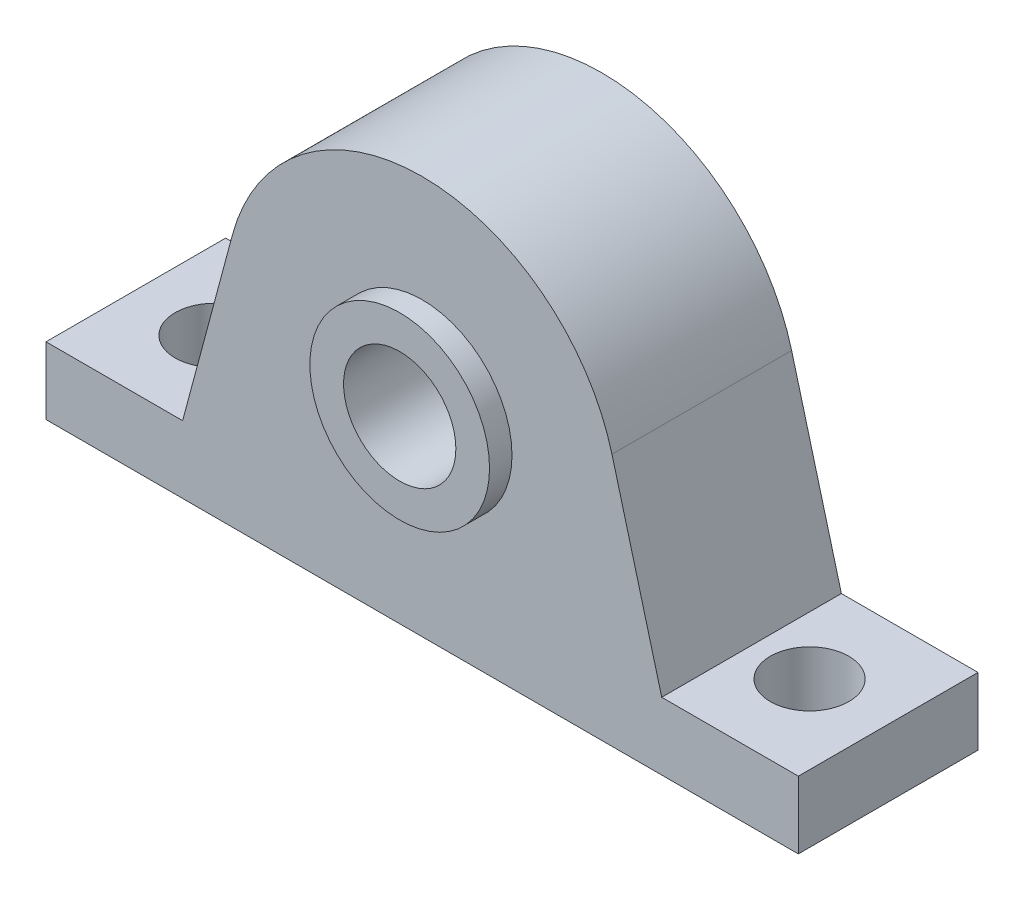
from build123d import *

# Parameters (mm, degrees)
SKETCH_1_R          = 5
EXTRUDE_1_DEPTH     = 16
SKETCH_2_R          = 8
SKETCH_2_R_2        = 5
EXTRUDE_2_DEPTH     = 2
SKETCH_3_R          = 3.5
CUT_EXTRUDE_1_DEPTH = 12


with BuildPart() as part:
    # 草图1 → 凸台-拉伸1 (new body)
    with BuildSketch(Plane.XY):
        with BuildLine():
            Line((-33.5, 6), (-33.5, 0))
            Line((-33.5, 0), (33.5, 0))
            Line((33.5, 0), (33.5, 6))
            Line((33.5, 6), (21.332723466, 6))
            Line((21.332723466, 6), (16.90370196, 22.529333289))
            ThreePointArc((16.90370196, 22.529333289), (0, 35.5), (-16.90370196, 22.529333289))
            Line((-16.90370196, 22.529333289), (-21.332723466, 6))
            Line((-21.332723466, 6), (-33.5, 6))
        make_face()
        with Locations((0, 18)):
            Circle(SKETCH_1_R, mode=Mode.SUBTRACT)
    extrude(amount=EXTRUDE_1_DEPTH)

    # 草图2 → 凸台-拉伸2 (add)
    with BuildSketch(Plane.XY.offset(16)):
        with Locations((0, 18)):
            Circle(SKETCH_2_R)
        with Locations((0, 18)):
            Circle(SKETCH_2_R_2, mode=Mode.SUBTRACT)
    extrude(amount=EXTRUDE_2_DEPTH)

    # 草图3 → 切除-拉伸1 (cut)
    with BuildSketch(Plane(origin=(0, 6, 0), x_dir=(1, 0, 0), z_dir=(0, 1, 0))):
        with Locations((-26.5, -8)):
            Circle(SKETCH_3_R)
        with Locations((26.5, -8)):
            Circle(SKETCH_3_R)
    extrude(amount=-CUT_EXTRUDE_1_DEPTH, mode=Mode.SUBTRACT)


solid = part.part
